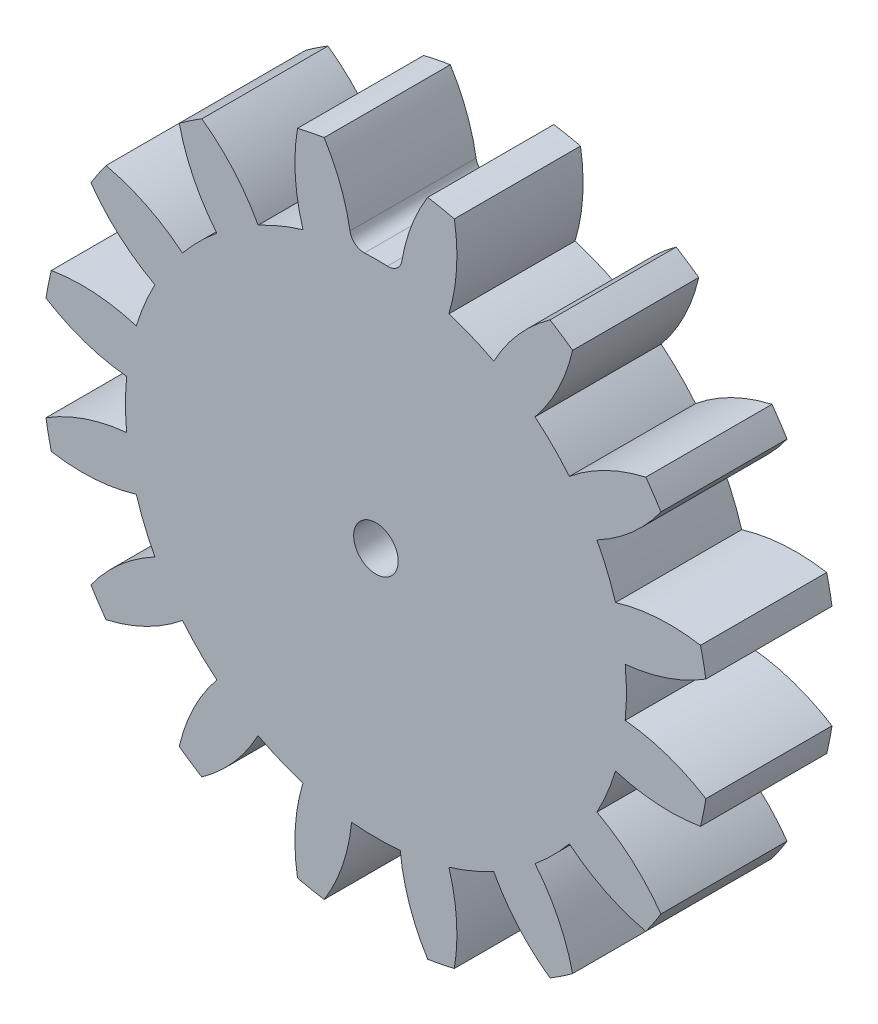
from build123d import *

# Parameters (mm, degrees)
SKETCH1_R           = 22.5
SKETCH1_R_2         = 1.5
BOSS_EXTRUDE1_DEPTH = 4.25
CUT_EXTRUDE1_DEPTH  = 33.102375302
FILLET1_R           = 0.95
CIRPATTERN3_COUNT   = 16


with BuildPart() as part:
    # Sketch1 → Boss-Extrude1 (new, symmetric)
    with BuildSketch(Plane.XY):
        Circle(SKETCH1_R)
        Circle(SKETCH1_R_2, mode=Mode.SUBTRACT)
    extrude(amount=BOSS_EXTRUDE1_DEPTH, both=True)

    # Sketch2 → Cut-Extrude1 (cut, symmetric)
    with BuildSketch(Plane.XY):
        with BuildLine():
            ThreePointArc((1.637057312, 16.795406168), (0, 16.875), (-1.637057312, 16.795406168))
            ThreePointArc((-1.637057312, 16.795406168), (-2.247114369, 19.619173601), (-3.48804499, 22.227990061))
            ThreePointArc((-3.48804499, 22.227990061), (0, 22.5), (3.48804499, 22.227990061))
            ThreePointArc((3.48804499, 22.227990061), (2.247114369, 19.619173601), (1.637057312, 16.795406168))
        make_face()
    cut_extrude1 = extrude(amount=CUT_EXTRUDE1_DEPTH, both=True, mode=Mode.SUBTRACT)

    # Fillet1
    fillet1_edges = [part.edges().sort_by_distance(p)[0] for p in [
        (1.637057312, 16.795406168, 0),
        (-1.637057312, 16.795406168, 0),
    ]]
    fillet(fillet1_edges, radius=FILLET1_R)

    # CirPattern3: Cut-Extrude1 ×16 about axis
    cirpattern3_axis = Axis((0, 0, 4.25), (0, 0, -1))
    for i in range(1, CIRPATTERN3_COUNT):
        add(cut_extrude1.rotate(cirpattern3_axis, i * 360 / CIRPATTERN3_COUNT), mode=Mode.SUBTRACT)


solid = part.part
